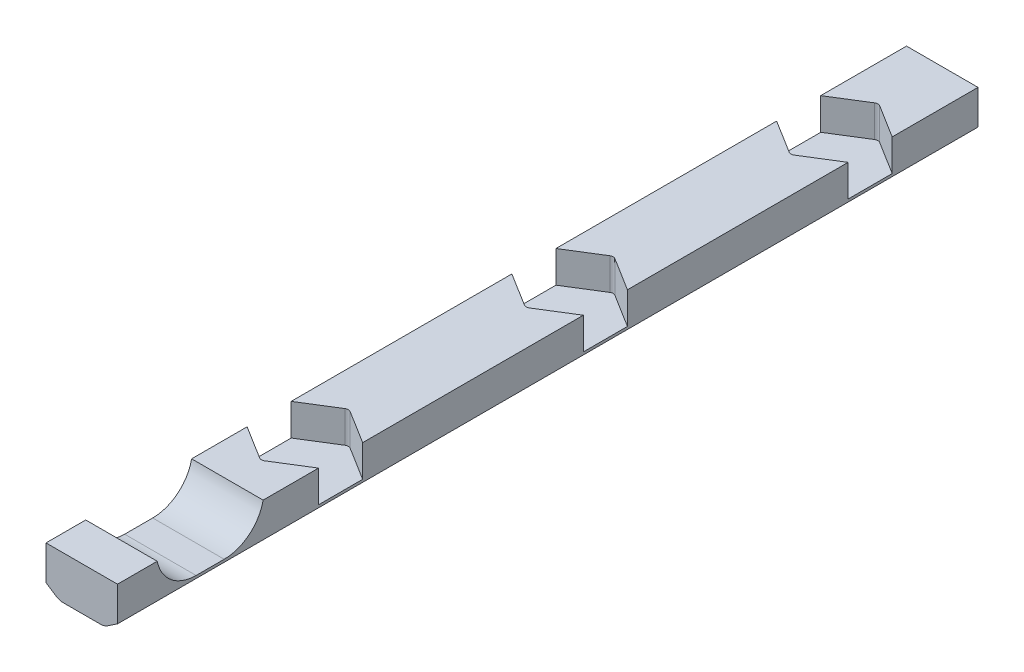
from build123d import *

# Parameters (mm, degrees)
BOSS_EXTRUDE1_DEPTH = 65
FILLET3_R           = 1
FILLET4_R           = 1
CUT_EXTRUDE1_DEPTH  = 2.4
LPATTERN1_COUNT     = 3
LPATTERN1_PITCH     = 20
SKETCH3_W           = 5.4
SKETCH3_H           = 8
CUT_EXTRUDE2_DEPTH  = 2.4
FILLET5_R           = 3
FILLET6_R           = 0.35


with BuildPart() as part:
    # Sketch1 → Boss-Extrude1 (new body)
    with BuildSketch(Plane.XY):
        Polygon((0, 0), (3.4, 0), (4.4, 0.663324958), (4.4, 3.263324958), (-1, 3.263324958), (-1, 0.663324958), align=None)
    extrude(amount=BOSS_EXTRUDE1_DEPTH)

    # Fillet3
    fillet3_edges = [part.edges().sort_by_distance(p)[0] for p in [
        (3.4, 0, 32.5),
    ]]
    fillet(fillet3_edges, radius=FILLET3_R)

    # Fillet4
    fillet4_edges = [part.edges().sort_by_distance(p)[0] for p in [
        (0, 0, 32.5),
    ]]
    fillet(fillet4_edges, radius=FILLET4_R)

    # Sketch2 → Cut-Extrude1 (cut)
    with BuildSketch(Plane(origin=(0, 3.263324958, 0), x_dir=(1, 0, 0), z_dir=(0, 1, 0))):
        Polygon((4.4, -9.81), (4.4, -6.48), (1.7, -4.8), (-1, -6.48), (-1, -9.81), (1.7, -11.49), align=None)
    cut_extrude1 = extrude(amount=-CUT_EXTRUDE1_DEPTH, mode=Mode.SUBTRACT)

    # LPattern1: Cut-Extrude1 ×3
    with Locations(*[(0, 0, i * LPATTERN1_PITCH) for i in range(1, LPATTERN1_COUNT)]):
        add(cut_extrude1, mode=Mode.SUBTRACT)

    # Sketch3 → Cut-Extrude2 (cut)
    with BuildSketch(Plane(origin=(0, 3.263324958, 0), x_dir=(1, 0, 0), z_dir=(0, 1, 0))):
        with Locations((1.7, -58)):
            Rectangle(SKETCH3_W, SKETCH3_H)
    extrude(amount=-CUT_EXTRUDE2_DEPTH, mode=Mode.SUBTRACT)

    # Fillet5
    # the kernel refuses this fillet: 3 mm, written as the material it adds along each edge
    with BuildSketch(Plane(origin=(4.4, 0.863324958, 54), x_dir=(0, 0, 1), z_dir=(-1, 0, 0))) as fillet5_piece_1:
        with BuildLine():
            CenterArc((2.939387691, 3), FILLET5_R, 191.536959033, 78.463040967)
            Line((0, 2.4), (-0.058787754, 2.388))
            ThreePointArc((-0.058787754, 2.388), (-0.06, 1.2), (-0.06, 0))
            Line((-0.06, 0), (0, -0.06))
            Line((0, -0.06), (2.939387691, -0.06))
            Line((2.939387691, -0.06), (2.939387691, 0))
        make_face()
    extrude(amount=5.4)
    with BuildSketch(Plane(origin=(-1, 0.863324958, 62), x_dir=(0, 1.0, -1.5483910450100627e-12), z_dir=(1, 0, 0))) as fillet5_piece_2:
        with BuildLine():
            CenterArc((3, -2.939387691), FILLET5_R, 101.536959033, 78.463040967)
            Line((0, -2.939387691), (-0.06, -2.939387691))
            Line((-0.06, -2.939387691), (-0.06, 0))
            Line((-0.06, 0), (0, 0.06))
            ThreePointArc((0, 0.06), (1.2, 0.06), (2.388, 0.058787754))
            Line((2.388, 0.058787754), (2.4, 0))
        make_face()
    extrude(amount=5.4)

    # Fillet6
    fillet6_edges = [part.edges().sort_by_distance(p)[0] for p in [
        (1.7, 2.063324958, 11.49),
        (1.7, 2.063324958, 4.8),
        (1.7, 2.063324958, 31.49),
        (1.7, 2.063324958, 24.8),
        (1.7, 2.063324958, 51.49),
        (1.7, 2.063324958, 44.8),
    ]]
    fillet(fillet6_edges, radius=FILLET6_R)


solid = part.part
